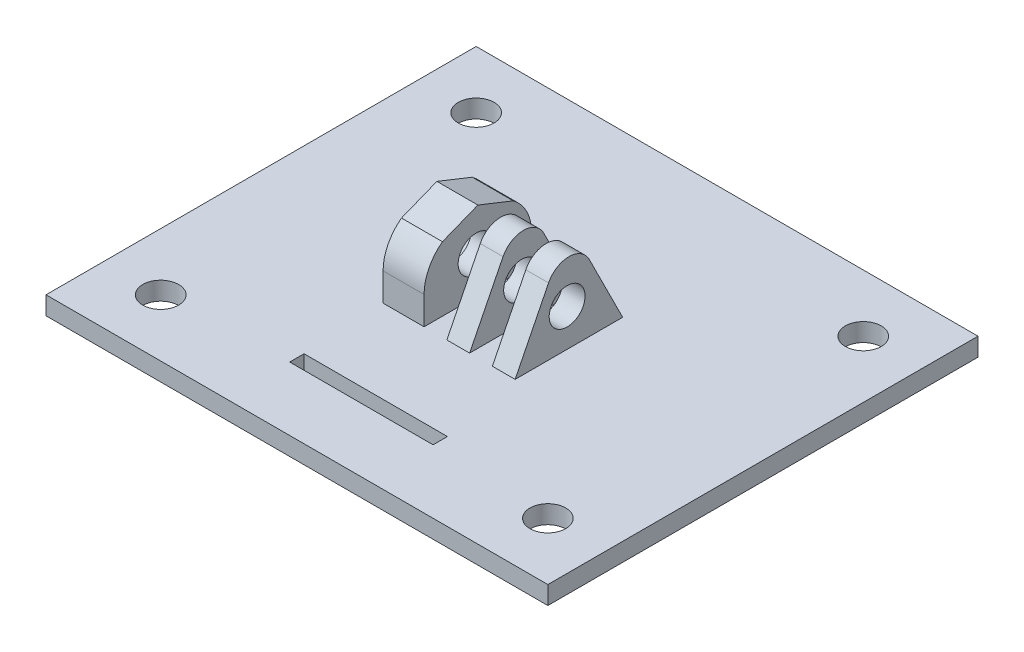
from build123d import *

# Parameters (mm, degrees)
SKETCH1_W                 = 70
SKETCH1_H                 = 60
SKETCH1_R                 = 2.5
BOSS_EXTRUDE1_DEPTH       = 2.54
SKETCH2_R                 = 1.651
BOSS_EXTRUDE2_DEPTH       = 7.9375
SKETCH3_W                 = 3.175
SKETCH3_H                 = 15
CUT_EXTRUDE1_DEPTH        = 15
FILLET1_R                 = 3.175
SKETCH6_W                 = 15
SKETCH6_H                 = 10.16
SKETCH6_R                 = 1.651
BOSS_EXTRUDE5_DEPTH       = 3.175
BOSS_EXTRUDE6_DEPTH       = 2.54
FILLET2_R                 = 6.35
F_5_0MM_DOWEL_HOLE1_D     = 5
F_5_0MM_DOWEL_HOLE1_DEPTH = 20
F_5_0MM_DOWEL_HOLE1_TIP   = 1.502151548
SKETCH10_W                = 20
SKETCH10_H                = 2
CUT_EXTRUDE2_DEPTH        = 10
BOSS_EXTRUDE8_DEPTH       = 2.54
CUT_EXTRUDE3_START        = -6.35
CUT_EXTRUDE3_DEPTH        = 6.35


with BuildPart() as part:
    # Sketch1 → Boss-Extrude1 (new body)
    with BuildSketch(Plane(origin=(0, 0, 0), x_dir=(1, 0, 0), z_dir=(0, 1, 0))):
        with Locations((0, 30)):
            Rectangle(SKETCH1_W, SKETCH1_H)
        with Locations(Location((-27, 52, 0), (0, 0, 270))):
            Circle(SKETCH1_R, mode=Mode.SUBTRACT)
        with Locations(Location((-27, 8, 0), (0, 0, 270))):
            Circle(SKETCH1_R, mode=Mode.SUBTRACT)
        with Locations(Location((27, 52, 0), (0, 0, 270))):
            Circle(SKETCH1_R, mode=Mode.SUBTRACT)
        with Locations(Location((27, 8, 0), (0, 0, 270))):
            Circle(SKETCH1_R, mode=Mode.SUBTRACT)
    extrude(amount=BOSS_EXTRUDE1_DEPTH)

    # Sketch2 → Boss-Extrude2 (add, symmetric)
    with BuildSketch(Plane(origin=(0, 0, 0), x_dir=(0, 0, -1), z_dir=(1, 0, 0))):
        Polygon((37.5, 2.54), (30, 17.54), (22.5, 2.54), align=None)
        with Locations((30, 7.62)):
            Circle(SKETCH2_R, mode=Mode.SUBTRACT)
    extrude(amount=BOSS_EXTRUDE2_DEPTH, both=True)

    # Sketch3 → Cut-Extrude1 (cut)
    with BuildSketch(Plane(origin=(0, 2.54, 0), x_dir=(1, 0, 0), z_dir=(0, 1, 0))):
        with Locations((-3.175, 30)):
            Rectangle(SKETCH3_W, SKETCH3_H)
        with Locations((3.175, 30)):
            Rectangle(SKETCH3_W, SKETCH3_H)
    extrude(amount=CUT_EXTRUDE1_DEPTH, mode=Mode.SUBTRACT)

    # Fillet1
    fillet1_edges = [part.edges().sort_by_distance(p)[0] for p in [
        (6.35, 17.54, -30),
        (-6.35, 17.54, -30),
        (0, 17.54, -30),
    ]]
    fillet(fillet1_edges, radius=FILLET1_R)

    # Sketch6 → Boss-Extrude5 (add)
    with BuildSketch(Plane.ZY.offset(7.9375)):
        with Locations((-30, 7.62)):
            Rectangle(SKETCH6_W, SKETCH6_H)
        with Locations((-30, 7.62)):
            Circle(SKETCH6_R, mode=Mode.SUBTRACT)
    extrude(amount=-BOSS_EXTRUDE5_DEPTH)

    # Sketch4 → Boss-Extrude6 (add)
    with BuildSketch(Plane.ZY.offset(7.9375)):
        Polygon((-37.5, 11.54), (-37.5, 2.54), (-22.5, 2.54), (-22.5, 11.54), (-28.589639166, 11.54), (-25.9, 9.987136104), (-25.9, 5.252863896), (-30, 2.885727793), (-34.1, 5.252863896), (-34.1, 9.987136104), (-31.410360834, 11.54), align=None)
    extrude(amount=BOSS_EXTRUDE6_DEPTH)

    # Fillet2
    # the kernel refuses this fillet: 6.35 mm, written as the material it takes off along each edge
    with BuildSketch(Plane(origin=(-23.580984977, 12.7, -22.5), x_dir=(0, 0, -1), z_dir=(1, 0, 0))) as fillet2_piece_1:
        with BuildLine():
            CenterArc((6.35, -6.257393991), FILLET2_R, 99.79714572, 80.202854281)
            Line((0, -6.257393991), (-0.127, -6.257393991))
            Line((-0.127, -6.257393991), (-0.127, 0))
            Line((-0.127, 0), (0, 0.127))
            ThreePointArc((0, 0.127), (2.634740701, 0.127), (5.247871029, 0.12514788))
            Line((5.247871029, 0.12514788), (5.269481401, 0))
        make_face()
    extrude(amount=34.461969954, mode=Mode.SUBTRACT)
    with BuildSketch(Plane(origin=(-23.580984977, 12.7, -37.5), x_dir=(0, 0, 1), z_dir=(1, 0, 0))) as fillet2_piece_2:
        with BuildLine():
            CenterArc((6.35, 6.257393991), FILLET2_R, 180, 80.202854281)
            Line((0, 6.257393991), (-0.127, 6.257393991))
            Line((-0.127, 6.257393991), (-0.127, 0))
            Line((-0.127, 0), (0, -0.127))
            ThreePointArc((0, -0.127), (2.634740701, -0.127), (5.247871029, -0.12514788))
            Line((5.247871029, -0.12514788), (5.269481401, 0))
        make_face()
    extrude(amount=34.461969954, mode=Mode.SUBTRACT)

    # Ø5.0mm Dowel Hole1
    with Locations(Plane(origin=(7.9375, 0, 0), x_dir=(0, 0, -1), z_dir=(1, 0, 0))):
        with Locations((29.751144641, 7.740920916)):
            Hole(F_5_0MM_DOWEL_HOLE1_D / 2, depth=F_5_0MM_DOWEL_HOLE1_DEPTH)
            with Locations((0, 0, -(F_5_0MM_DOWEL_HOLE1_DEPTH + F_5_0MM_DOWEL_HOLE1_TIP / 2))):  # 118° drill point
                Cone(0, F_5_0MM_DOWEL_HOLE1_D / 2, F_5_0MM_DOWEL_HOLE1_TIP, mode=Mode.SUBTRACT)

    # Sketch10 → Cut-Extrude2 (cut)
    with BuildSketch(Plane(origin=(0, 2.54, 0), x_dir=(1, 0, 0), z_dir=(0, 1, 0))):
        with Locations((0.117809829, 9.874502057)):
            Rectangle(SKETCH10_W, SKETCH10_H)
    extrude(amount=-CUT_EXTRUDE2_DEPTH, mode=Mode.SUBTRACT)

    # Sketch12 → Boss-Extrude8 (add)
    with BuildSketch(Plane.ZY.offset(7.9375)):
        Polygon((-31.410360834, 11.54), (-30, 12.354272207), (-28.589639166, 11.54), (-25.063302956, 11.54), (-30, 13.500615067), (-34.936697044, 11.54), align=None)
    extrude(amount=BOSS_EXTRUDE8_DEPTH)

    # Sketch13 → Cut-Extrude3 (cut)
    with BuildSketch(Plane.ZY.offset(7.9375).offset(CUT_EXTRUDE3_START)):
        with BuildLine():
            Line((-34.936697044, 11.54), (-30, 13.500615067))
            Line((-30, 13.500615067), (-25.063302956, 11.54))
            ThreePointArc((-25.063302956, 11.54), (-26.34823122, 12.279013549), (-27.769481401, 12.7))
            ThreePointArc((-27.769481401, 12.7), (-30, 13.615484171), (-32.230518599, 12.7))
            ThreePointArc((-32.230518599, 12.7), (-33.65176878, 12.279013549), (-34.936697044, 11.54))
        make_face()
    extrude(amount=CUT_EXTRUDE3_DEPTH, mode=Mode.SUBTRACT)


solid = part.part
